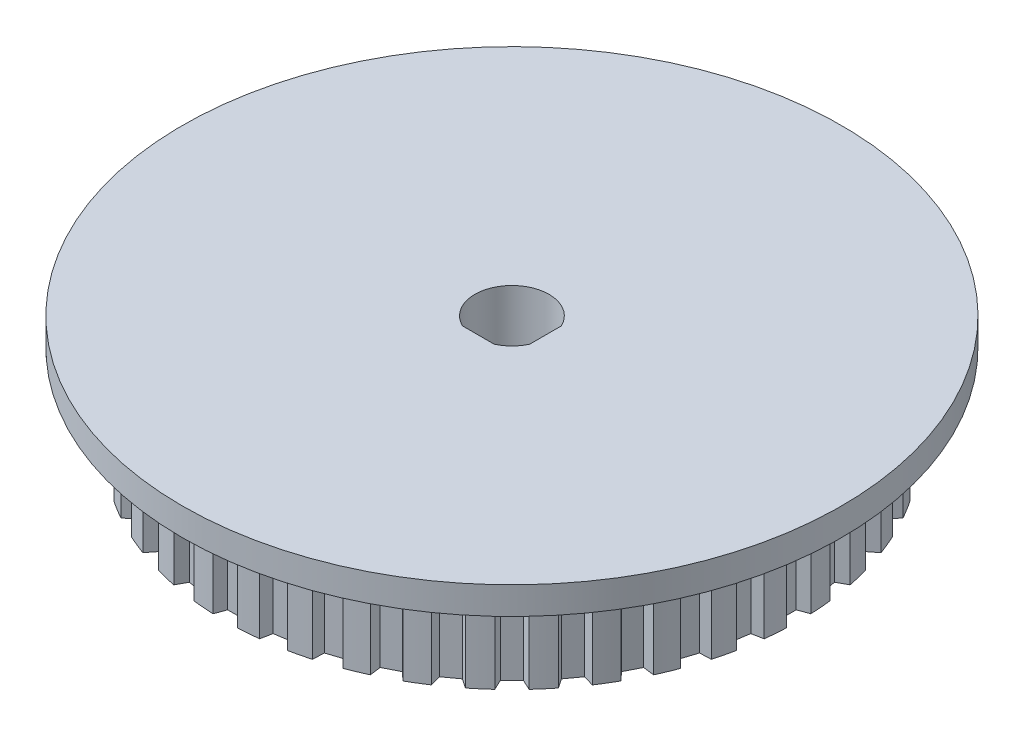
from build123d import *

# Parameters (mm, degrees)
EXTRUDE_1_DEPTH     = 10.2
SKETCH_2_R          = 36
EXTRUDE_2_DEPTH     = 3
CUT_EXTRUDE_5_DEPTH = 10
SKETCH_6_R          = 25
SKETCH_6_R_2        = 7.5
CUT_EXTRUDE_3_DEPTH = 10
CUT_EXTRUDE_START   = -3.2
SKETCH_7_R          = 4.05
CUT_EXTRUDE_4_DEPTH = 3.2
SKETCH_8_R          = 7.5
SKETCH_8_R_2        = 4.05
EXTRUDE_6_DEPTH     = 3


with BuildPart() as part:
    # Эскиз1 → Вытянуть1 (new body)
    with BuildSketch(Plane(origin=(0, 0, 0), x_dir=(1, 0, 0), z_dir=(0, 1, 0))):
        with BuildLine():
            Line((-0.9, 30.15), (0.9, 30.15))
            Line((0.9, 30.15), (1.326544618, 31.321921706))
            ThreePointArc((1.326544618, 31.321921706), (2.459692651, 31.253358413), (3.589615414, 31.143814172))
            Line((3.589615414, 31.143814172), (3.827579614, 29.919594487))
            Line((3.827579614, 29.919594487), (5.605418627, 29.63801245))
            Line((5.605418627, 29.63801245), (6.210040719, 30.728779577))
            ThreePointArc((6.210040719, 30.728779577), (7.318512157, 30.483797004), (8.417387201, 30.198842572))
            Line((8.417387201, 30.198842572), (8.460911516, 28.952469261))
            Line((8.460911516, 28.952469261), (10.172813245, 28.396238671))
            Line((10.172813245, 28.396238671), (10.940625007, 29.378992911))
            ThreePointArc((10.940625007, 29.378992911), (11.997125605, 28.963623344), (13.037894979, 28.510275244))
            Line((13.037894979, 28.510275244), (12.885907695, 27.272438154))
            Line((12.885907695, 27.272438154), (14.489719439, 26.455255255))
            Line((14.489719439, 26.455255255), (15.401814798, 27.305797936))
            ThreePointArc((15.401814798, 27.305797936), (16.380330004, 26.730269153), (17.337366513, 26.11969032))
            Line((17.337366513, 26.11969032), (16.993610062, 24.920869107))
            Line((16.993610062, 24.920869107), (18.449840652, 23.862855653))
            Line((18.449840652, 23.862855653), (19.483760792, 24.560243594))
            ThreePointArc((19.483760792, 24.560243594), (20.360196315, 23.838727022), (21.209934543, 23.085951933))
            Line((21.209934543, 23.085951933), (20.68287335, 21.955665556))
            Line((20.68287335, 21.955665556), (21.955665556, 20.68287335))
            Line((21.955665556, 20.68287335), (23.085951933, 21.209934543))
            ThreePointArc((23.085951933, 21.209934543), (23.838727022, 20.360196315), (24.560243594, 19.483760792))
            Line((24.560243594, 19.483760792), (23.862855653, 18.449840652))
            Line((23.862855653, 18.449840652), (24.920869107, 16.993610062))
            Line((24.920869107, 16.993610062), (26.11969032, 17.337366513))
            ThreePointArc((26.11969032, 17.337366513), (26.730269152, 16.380330004), (27.305797936, 15.401814798))
            Line((27.305797936, 15.401814798), (26.455255255, 14.489719439))
            Line((26.455255255, 14.489719439), (27.272438154, 12.885907695))
            Line((27.272438154, 12.885907695), (28.510275244, 13.037894979))
            ThreePointArc((28.510275244, 13.037894979), (28.963623344, 11.997125605), (29.378992911, 10.940625007))
            Line((29.378992911, 10.940625007), (28.396238671, 10.172813245))
            Line((28.396238671, 10.172813245), (28.952469261, 8.460911516))
            Line((28.952469261, 8.460911516), (30.198842572, 8.417387201))
            ThreePointArc((30.198842572, 8.417387201), (30.483797004, 7.318512157), (30.728779577, 6.210040719))
            Line((30.728779577, 6.210040719), (29.63801245, 5.605418628))
            Line((29.63801245, 5.605418628), (29.919594487, 3.827579614))
            Line((29.919594487, 3.827579614), (31.143814172, 3.589615414))
            ThreePointArc((31.143814172, 3.589615414), (31.253358413, 2.459692651), (31.321921706, 1.326544618))
            Line((31.321921706, 1.326544618), (30.15, 0.9))
            Line((30.15, 0.9), (30.15, -0.9))
            Line((30.15, -0.9), (31.321921706, -1.326544618))
            ThreePointArc((31.321921706, -1.326544618), (31.253358413, -2.459692651), (31.143814172, -3.589615414))
            Line((31.143814172, -3.589615414), (29.919594487, -3.827579614))
            Line((29.919594487, -3.827579614), (29.63801245, -5.605418627))
            Line((29.63801245, -5.605418627), (30.728779577, -6.210040719))
            ThreePointArc((30.728779577, -6.210040719), (30.483797004, -7.318512157), (30.198842572, -8.417387201))
            Line((30.198842572, -8.417387201), (28.952469261, -8.460911516))
            Line((28.952469261, -8.460911516), (28.396238671, -10.172813245))
            Line((28.396238671, -10.172813245), (29.378992911, -10.940625007))
            ThreePointArc((29.378992911, -10.940625007), (28.963623344, -11.997125605), (28.510275244, -13.037894979))
            Line((28.510275244, -13.037894979), (27.272438154, -12.885907695))
            Line((27.272438154, -12.885907695), (26.455255255, -14.489719439))
            Line((26.455255255, -14.489719439), (27.305797936, -15.401814798))
            ThreePointArc((27.305797936, -15.401814798), (26.730269152, -16.380330004), (26.11969032, -17.337366513))
            Line((26.11969032, -17.337366513), (24.920869107, -16.993610062))
            Line((24.920869107, -16.993610062), (23.862855653, -18.449840652))
            Line((23.862855653, -18.449840652), (24.560243594, -19.483760792))
            ThreePointArc((24.560243594, -19.483760792), (23.838727022, -20.360196315), (23.085951933, -21.209934543))
            Line((23.085951933, -21.209934543), (21.955665556, -20.68287335))
            Line((21.955665556, -20.68287335), (20.68287335, -21.955665556))
            Line((20.68287335, -21.955665556), (21.209934543, -23.085951933))
            ThreePointArc((21.209934543, -23.085951933), (20.360196315, -23.838727022), (19.483760792, -24.560243594))
            Line((19.483760792, -24.560243594), (18.449840652, -23.862855653))
            Line((18.449840652, -23.862855653), (16.993610062, -24.920869107))
            Line((16.993610062, -24.920869107), (17.337366513, -26.11969032))
            ThreePointArc((17.337366513, -26.11969032), (16.380330004, -26.730269152), (15.401814798, -27.305797936))
            Line((15.401814798, -27.305797936), (14.489719439, -26.455255255))
            Line((14.489719439, -26.455255255), (12.885907695, -27.272438154))
            Line((12.885907695, -27.272438154), (13.037894979, -28.510275244))
            ThreePointArc((13.037894979, -28.510275244), (11.997125605, -28.963623344), (10.940625007, -29.378992911))
            Line((10.940625007, -29.378992911), (10.172813245, -28.396238671))
            Line((10.172813245, -28.396238671), (8.460911516, -28.952469261))
            Line((8.460911516, -28.952469261), (8.417387201, -30.198842572))
            ThreePointArc((8.417387201, -30.198842572), (7.318512157, -30.483797004), (6.210040719, -30.728779577))
            Line((6.210040719, -30.728779577), (5.605418627, -29.63801245))
            Line((5.605418627, -29.63801245), (3.827579614, -29.919594487))
            Line((3.827579614, -29.919594487), (3.589615414, -31.143814172))
            ThreePointArc((3.589615414, -31.143814172), (2.459692651, -31.253358413), (1.326544618, -31.321921706))
            Line((1.326544618, -31.321921706), (0.9, -30.15))
            Line((0.9, -30.15), (-0.9, -30.15))
            Line((-0.9, -30.15), (-1.326544618, -31.321921706))
            ThreePointArc((-1.326544618, -31.321921706), (-2.459692651, -31.253358413), (-3.589615414, -31.143814172))
            Line((-3.589615414, -31.143814172), (-3.827579614, -29.919594487))
            Line((-3.827579614, -29.919594487), (-5.605418627, -29.63801245))
            Line((-5.605418627, -29.63801245), (-6.210040719, -30.728779577))
            ThreePointArc((-6.210040719, -30.728779577), (-7.318512157, -30.483797004), (-8.417387201, -30.198842572))
            Line((-8.417387201, -30.198842572), (-8.460911516, -28.952469261))
            Line((-8.460911516, -28.952469261), (-10.172813245, -28.396238671))
            Line((-10.172813245, -28.396238671), (-10.940625007, -29.378992911))
            ThreePointArc((-10.940625007, -29.378992911), (-11.997125605, -28.963623344), (-13.037894979, -28.510275244))
            Line((-13.037894979, -28.510275244), (-12.885907695, -27.272438154))
            Line((-12.885907695, -27.272438154), (-14.489719439, -26.455255255))
            Line((-14.489719439, -26.455255255), (-15.401814798, -27.305797936))
            ThreePointArc((-15.401814798, -27.305797936), (-16.380330004, -26.730269152), (-17.337366513, -26.11969032))
            Line((-17.337366513, -26.11969032), (-16.993610062, -24.920869107))
            Line((-16.993610062, -24.920869107), (-18.449840652, -23.862855653))
            Line((-18.449840652, -23.862855653), (-19.483760792, -24.560243594))
            ThreePointArc((-19.483760792, -24.560243594), (-20.360196315, -23.838727022), (-21.209934543, -23.085951933))
            Line((-21.209934543, -23.085951933), (-20.68287335, -21.955665556))
            Line((-20.68287335, -21.955665556), (-21.955665556, -20.68287335))
            Line((-21.955665556, -20.68287335), (-23.085951933, -21.209934543))
            ThreePointArc((-23.085951933, -21.209934543), (-23.838727022, -20.360196315), (-24.560243594, -19.483760792))
            Line((-24.560243594, -19.483760792), (-23.862855653, -18.449840652))
            Line((-23.862855653, -18.449840652), (-24.920869107, -16.993610062))
            Line((-24.920869107, -16.993610062), (-26.11969032, -17.337366513))
            ThreePointArc((-26.11969032, -17.337366513), (-26.730269152, -16.380330004), (-27.305797936, -15.401814798))
            Line((-27.305797936, -15.401814798), (-26.455255255, -14.489719439))
            Line((-26.455255255, -14.489719439), (-27.272438154, -12.885907695))
            Line((-27.272438154, -12.885907695), (-28.510275244, -13.037894979))
            ThreePointArc((-28.510275244, -13.037894979), (-28.963623344, -11.997125605), (-29.378992911, -10.940625007))
            Line((-29.378992911, -10.940625007), (-28.396238671, -10.172813245))
            Line((-28.396238671, -10.172813245), (-28.952469261, -8.460911516))
            Line((-28.952469261, -8.460911516), (-30.198842572, -8.417387201))
            ThreePointArc((-30.198842572, -8.417387201), (-30.483797004, -7.318512157), (-30.728779577, -6.210040719))
            Line((-30.728779577, -6.210040719), (-29.63801245, -5.605418627))
            Line((-29.63801245, -5.605418627), (-29.919594487, -3.827579614))
            Line((-29.919594487, -3.827579614), (-31.143814172, -3.589615414))
            ThreePointArc((-31.143814172, -3.589615414), (-31.253358413, -2.459692651), (-31.321921706, -1.326544618))
            Line((-31.321921706, -1.326544618), (-30.15, -0.9))
            Line((-30.15, -0.9), (-30.15, 0.9))
            Line((-30.15, 0.9), (-31.321921706, 1.326544618))
            ThreePointArc((-31.321921706, 1.326544618), (-31.253358413, 2.459692651), (-31.143814172, 3.589615414))
            Line((-31.143814172, 3.589615414), (-29.919594487, 3.827579614))
            Line((-29.919594487, 3.827579614), (-29.63801245, 5.605418628))
            Line((-29.63801245, 5.605418628), (-30.728779577, 6.210040719))
            ThreePointArc((-30.728779577, 6.210040719), (-30.483797004, 7.318512157), (-30.198842572, 8.417387201))
            Line((-30.198842572, 8.417387201), (-28.952469261, 8.460911516))
            Line((-28.952469261, 8.460911516), (-28.396238671, 10.172813245))
            Line((-28.396238671, 10.172813245), (-29.378992911, 10.940625007))
            ThreePointArc((-29.378992911, 10.940625007), (-28.963623344, 11.997125605), (-28.510275244, 13.037894979))
            Line((-28.510275244, 13.037894979), (-27.272438154, 12.885907695))
            Line((-27.272438154, 12.885907695), (-26.455255255, 14.489719439))
            Line((-26.455255255, 14.489719439), (-27.305797936, 15.401814798))
            ThreePointArc((-27.305797936, 15.401814798), (-26.730269152, 16.380330004), (-26.11969032, 17.337366513))
            Line((-26.11969032, 17.337366513), (-24.920869107, 16.993610062))
            Line((-24.920869107, 16.993610062), (-23.862855653, 18.449840652))
            Line((-23.862855653, 18.449840652), (-24.560243594, 19.483760792))
            ThreePointArc((-24.560243594, 19.483760792), (-23.838727022, 20.360196315), (-23.085951933, 21.209934543))
            Line((-23.085951933, 21.209934543), (-21.955665556, 20.68287335))
            Line((-21.955665556, 20.68287335), (-20.68287335, 21.955665556))
            Line((-20.68287335, 21.955665556), (-21.209934543, 23.085951933))
            ThreePointArc((-21.209934543, 23.085951933), (-20.360196315, 23.838727022), (-19.483760792, 24.560243594))
            Line((-19.483760792, 24.560243594), (-18.449840652, 23.862855653))
            Line((-18.449840652, 23.862855653), (-16.993610062, 24.920869107))
            Line((-16.993610062, 24.920869107), (-17.337366513, 26.11969032))
            ThreePointArc((-17.337366513, 26.11969032), (-16.380330004, 26.730269153), (-15.401814798, 27.305797936))
            Line((-15.401814798, 27.305797936), (-14.489719439, 26.455255255))
            Line((-14.489719439, 26.455255255), (-12.885907695, 27.272438154))
            Line((-12.885907695, 27.272438154), (-13.037894979, 28.510275244))
            ThreePointArc((-13.037894979, 28.510275244), (-11.997125605, 28.963623344), (-10.940625007, 29.378992911))
            Line((-10.940625007, 29.378992911), (-10.172813245, 28.396238671))
            Line((-10.172813245, 28.396238671), (-8.460911516, 28.952469261))
            Line((-8.460911516, 28.952469261), (-8.417387201, 30.198842572))
            ThreePointArc((-8.417387201, 30.198842572), (-7.318512157, 30.483797004), (-6.210040719, 30.728779577))
            Line((-6.210040719, 30.728779577), (-5.605418627, 29.63801245))
            Line((-5.605418627, 29.63801245), (-3.827579614, 29.919594487))
            Line((-3.827579614, 29.919594487), (-3.589615414, 31.143814172))
            ThreePointArc((-3.589615414, 31.143814172), (-2.459692651, 31.253358413), (-1.326544618, 31.321921706))
            Line((-1.326544618, 31.321921706), (-0.9, 30.15))
        make_face()
    extrude(amount=EXTRUDE_1_DEPTH)

    # Эскиз2 → Вытянуть2 (add)
    with BuildSketch(Plane(origin=(0, 10.2, 0), x_dir=(1, 0, 0), z_dir=(0, 1, 0))):
        Circle(SKETCH_2_R)
    extrude(amount=EXTRUDE_2_DEPTH)

    # Эскиз5 → Вытянуть5 (cut)
    with BuildSketch(Plane(origin=(0, 13.2, 0), x_dir=(1, 0, 0), z_dir=(0, 1, 0))):
        with BuildLine():
            Line((3.66427005, 1.725), (3.66427005, -1.725))
            ThreePointArc((3.66427005, -1.725), (2.863782464, -2.863782464), (1.725, -3.66427005))
            Line((1.725, -3.66427005), (-1.725, -3.66427005))
            ThreePointArc((-1.725, -3.66427005), (-2.863782464, 2.863782464), (3.66427005, 1.725))
        make_face()
    extrude(amount=-CUT_EXTRUDE_5_DEPTH, mode=Mode.SUBTRACT)

    # Эскиз6 → Вытянуть3 (cut)
    with BuildSketch(Plane.XZ):
        Circle(SKETCH_6_R)
        Circle(SKETCH_6_R_2, mode=Mode.SUBTRACT)
    extrude(amount=-CUT_EXTRUDE_3_DEPTH, mode=Mode.SUBTRACT)

    # Эскиз7 → Вытянуть4 (cut)
    with BuildSketch(Plane.XZ.offset(CUT_EXTRUDE_START)):
        Circle(SKETCH_7_R)
    extrude(amount=CUT_EXTRUDE_4_DEPTH, mode=Mode.SUBTRACT)

    # Эскиз8 → Вытянуть6 (add)
    with BuildSketch(Plane.XZ):
        Circle(SKETCH_8_R)
        Circle(SKETCH_8_R_2, mode=Mode.SUBTRACT)
    extrude(amount=EXTRUDE_6_DEPTH)


solid = part.part
